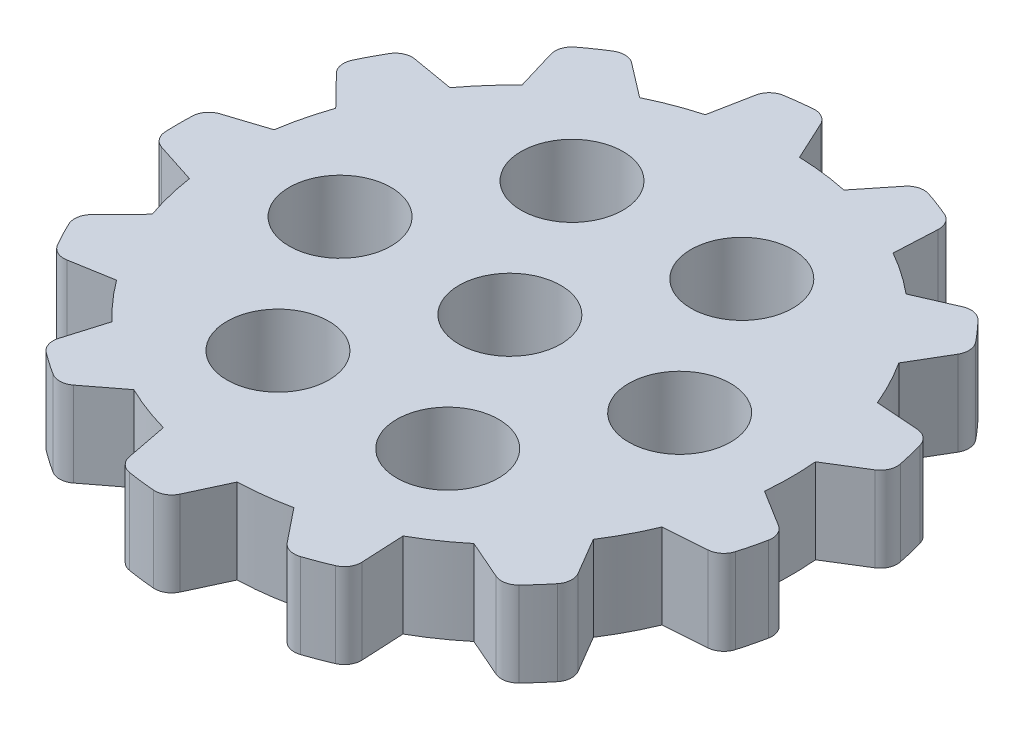
from build123d import *

# Parameters (mm, degrees)
TOOTH_DEPTH       = 6.35
CIRPATTERN2_COUNT = 13
FILLET1_START     = -1
FILLET1_DEPTH     = 8
CIRPATTERN4_COUNT = 13
BEARING_START     = -6.35
SKETCH2_R         = 17.145
SKETCH2_R_2       = 3.81
BEARING_DEPTH     = 6.35


with BuildPart() as part:
    # Sketch1 → tooth (new body)
    with BuildSketch(Plane(origin=(0, 0, 0), x_dir=(1, 0, 0), z_dir=(0, 1, 0))):
        with BuildLine():
            Line((20.955, 1.905), (24.430024666, 4.059448215))
            ThreePointArc((24.430024666, 4.059448215), (24.045374001, 5.92665286), (23.518231918, 7.758736523))
            Line((23.518231918, 7.758736523), (16.281852867, 5.371432977))
            ThreePointArc((16.281852867, 5.371432977), (17.094199899, 1.318846017), (16.913093955, -2.810387497))
            Line((16.913093955, -2.810387497), (24.430024666, -4.059448215))
            Line((24.430024666, -4.059448215), (20.955, -1.905))
            ThreePointArc((20.955, -1.905), (21.041412738, 0), (20.955, 1.905))
        make_face()
    tooth = extrude(amount=TOOTH_DEPTH)

    # CirPattern2: tooth ×13 about axis
    cirpattern2_axis = Axis((0, 0, 0), (0, 1, 0))
    for i in range(1, CIRPATTERN2_COUNT):
        add(tooth.rotate(cirpattern2_axis, i * 360 / CIRPATTERN2_COUNT))

    # Fillet1: read off the stored shape, not the designer's step
    # Fillet1 outline → Fillet1 (cut)
    with BuildSketch(Plane(origin=(0, 0, 0), x_dir=(1, 0, 0), z_dir=(0, 1, 0)).offset(FILLET1_START)):
        with BuildLine():
            Line((23.518231918, 7.758736523), (22.653265955, 7.820825329))
            ThreePointArc((22.653265955, 7.820825329), (23.360778925, 7.541702395), (23.781921552, 6.908359594))
            ThreePointArc((23.781921552, 6.908359594), (23.653898512, 7.334733136), (23.518231918, 7.758736523))
        make_face()
        with BuildLine():
            ThreePointArc((24.430024666, 4.059448215), (24.353107335, 4.497931535), (24.268320524, 4.934961391))
            ThreePointArc((24.268320524, 4.934961391), (24.189746323, 4.178449454), (23.692989596, 3.602500698))
            Line((23.692989596, 3.602500698), (24.430024666, 4.059448215))
        make_face()
    fillet1 = extrude(amount=FILLET1_DEPTH, mode=Mode.SUBTRACT)

    # CirPattern4: Fillet1 ×13 about axis
    cirpattern4_axis = Axis((0, 0, 0), (0, 1, 0))
    for i in range(1, CIRPATTERN4_COUNT):
        add(fillet1.rotate(cirpattern4_axis, i * 360 / CIRPATTERN4_COUNT), mode=Mode.SUBTRACT)

    # Sketch2 → bearing (add)
    with BuildSketch(Plane(origin=(0, 6.35, 0), x_dir=(1, 0, 0), z_dir=(0, 1, 0)).offset(BEARING_START)):
        Circle(SKETCH2_R)
        with Locations(Location((0, 0, 0), (0, 0, 270))):
            Circle(SKETCH2_R_2, mode=Mode.SUBTRACT)
        with Locations(Location((12.7, 0, 0), (0, 0, 270))):
            Circle(SKETCH2_R_2, mode=Mode.SUBTRACT)
        with Locations(Location((6.35, -10.998522628, 0), (0, 0, 270))):
            Circle(SKETCH2_R_2, mode=Mode.SUBTRACT)
        with Locations(Location((-6.35, -10.998522628, 0), (0, 0, 270))):
            Circle(SKETCH2_R_2, mode=Mode.SUBTRACT)
        with Locations(Location((-12.7, 0, 0), (0, 0, 270))):
            Circle(SKETCH2_R_2, mode=Mode.SUBTRACT)
        with Locations(Location((-6.35, 10.998522628, 0), (0, 0, 270))):
            Circle(SKETCH2_R_2, mode=Mode.SUBTRACT)
        with Locations(Location((6.35, 10.998522628, 0), (0, 0, 270))):
            Circle(SKETCH2_R_2, mode=Mode.SUBTRACT)
    extrude(amount=BEARING_DEPTH)


solid = part.part
